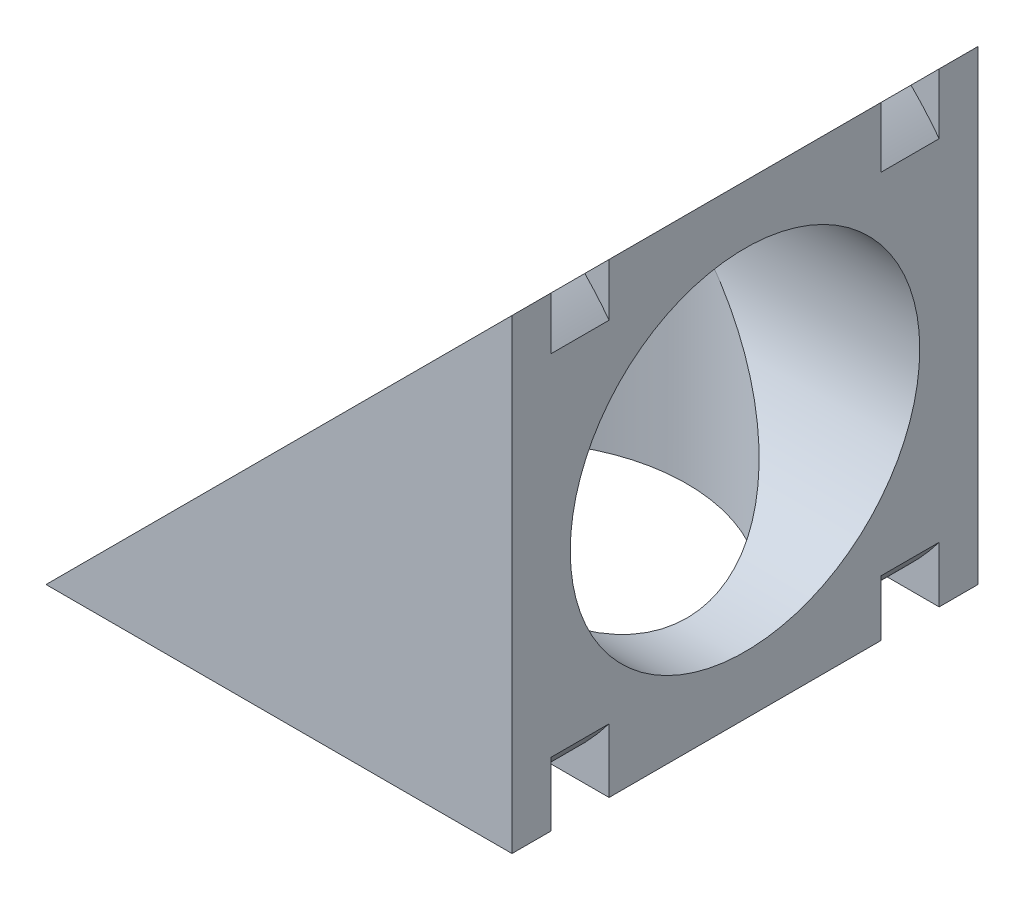
from build123d import *

# Parameters (mm, degrees)
SKETCH_1_W               = 24
SKETCH_1_H               = 24
EXTRUDE_1_DEPTH          = 24
SKETCH_2_W               = 71.732005
SKETCH_2_H               = 64.325513166
CUT_EXTRUDE_1_DEPTH      = 24
SKETCH_3_W               = 19.1
SKETCH_3_H               = 19.1
CUT_EXTRUDE_2_DEPTH      = 0.75
SKETCH_4_R               = 20.316156742
SKETCH_4_R_2             = 15
CUT_EXTRUDE_3_DEPTH      = 3
SKETCH_5_R               = 19.778815759
SKETCH_5_R_2             = 15
CUT_EXTRUDE_4_DEPTH      = 3
SKETCH_6_R               = 1.2
CUT_EXTRUDE_5_DEPTH      = 8
CUT_EXTRUDE_6_DEPTH      = 0.1
CUT_EXTRUDE_6_DEPTH_BACK = 0.1
SKETCH_7_W               = 8.073607186
SKETCH_7_H               = 16
SKETCH_8_R               = 9
CUT_EXTRUDE_7_DEPTH      = 30
SKETCH_9_R               = 9
CUT_EXTRUDE_8_DEPTH      = 30


with BuildPart() as part:
    # Эскиз1 → Бобышка-Вытянуть1 (new body)
    with BuildSketch(Plane(origin=(0, 0, 0), x_dir=(1, 0, 0), z_dir=(0, 1, 0))):
        Rectangle(SKETCH_1_W, SKETCH_1_H)
    extrude(amount=EXTRUDE_1_DEPTH)

    # Эскиз2 → Вырез-Вытянуть1 (cut)
    with BuildSketch(Plane(origin=(-6, 6, 0), x_dir=(0.7071067811865477, 0.7071067811865475, 0), z_dir=(-0.7071067811865475, 0.7071067811865477, 0))):
        Rectangle(SKETCH_2_W, SKETCH_2_H)
    extrude(amount=CUT_EXTRUDE_1_DEPTH, mode=Mode.SUBTRACT)

    # Эскиз3 → Вырез-Вытянуть2 (cut)
    with BuildSketch(Plane(origin=(-6, 6, 0), x_dir=(0.7071067811865476, 0.7071067811865476, 0), z_dir=(-0.7071067811865476, 0.7071067811865476, 0))):
        with Locations((8.485281374, 0)):
            Rectangle(SKETCH_3_W, SKETCH_3_H)
    extrude(amount=-CUT_EXTRUDE_2_DEPTH, mode=Mode.SUBTRACT)

    # Эскиз4 → Вырез-Вытянуть3 (cut)
    with BuildSketch(Plane.XY.offset(10)):
        with Locations((0, 12.288929334)):
            Circle(SKETCH_4_R)
        with Locations((0, 12.288929334)):
            Circle(SKETCH_4_R_2, mode=Mode.SUBTRACT)
    extrude(amount=-CUT_EXTRUDE_3_DEPTH, mode=Mode.SUBTRACT)

    # Эскиз5 → Вырез-Вытянуть4 (cut)
    with BuildSketch(Plane.XY.offset(-10)):
        with Locations((0, 11.885010241)):
            Circle(SKETCH_5_R)
        with Locations((0, 11.885010241)):
            Circle(SKETCH_5_R_2, mode=Mode.SUBTRACT)
    extrude(amount=CUT_EXTRUDE_4_DEPTH, mode=Mode.SUBTRACT)

    # Эскиз6 → Вырез-Вытянуть5 (cut)
    with BuildSketch(Plane(origin=(0, 0, 0), x_dir=(1, 0, 0), z_dir=(0, 1, 0))):
        Circle(SKETCH_6_R)
    extrude(amount=CUT_EXTRUDE_5_DEPTH, mode=Mode.SUBTRACT)

    # Эскиз7 → Вырез-Вытянуть6 (cut, two sides: drawn at the far end of the back side and taken through both)
    with BuildSketch(Plane(origin=(0, 0, 0), x_dir=(0, 0, -1), z_dir=(1, 0, 0)).offset(-CUT_EXTRUDE_6_DEPTH_BACK)):
        Rectangle(SKETCH_7_W, SKETCH_7_H)
    extrude(amount=CUT_EXTRUDE_6_DEPTH + CUT_EXTRUDE_6_DEPTH_BACK, mode=Mode.SUBTRACT)

    # Эскиз8 → Вырез-Вытянуть7 (cut)
    with BuildSketch(Plane(origin=(0, 0, 0), x_dir=(1, 0, 0), z_dir=(0, 1, 0))):
        Circle(SKETCH_8_R)
    extrude(amount=CUT_EXTRUDE_7_DEPTH, mode=Mode.SUBTRACT)

    # Эскиз9 → Вырез-Вытянуть8 (cut)
    with BuildSketch(Plane(origin=(0, 0, 0), x_dir=(0, 0, -1), z_dir=(1, 0, 0))):
        with Locations((0, 12)):
            Circle(SKETCH_9_R)
    extrude(amount=CUT_EXTRUDE_8_DEPTH, mode=Mode.SUBTRACT)


solid = part.part
